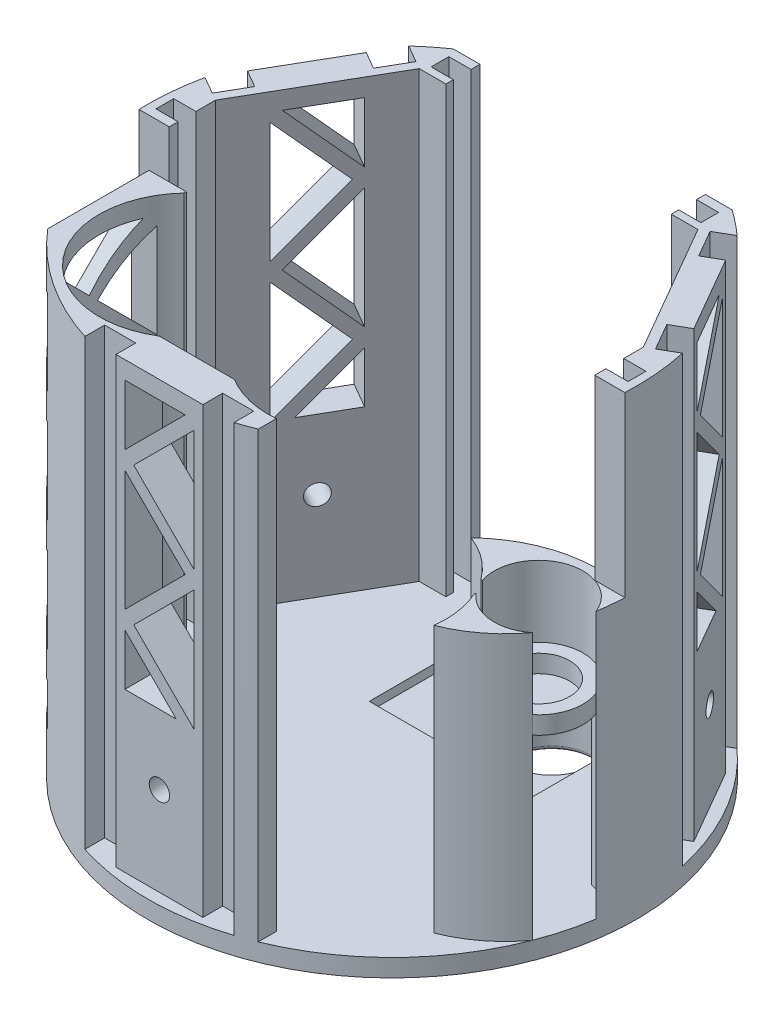
from build123d import *
from build123d.topology import SkipClean

# Parameters (mm, degrees)
BOSS_EXTRUDE1_DEPTH   = 50
BOSS_EXTRUDE1_2_DEPTH = 50
BOSS_EXTRUDE1_3_DEPTH = 50
BOSS_EXTRUDE1_4_DEPTH = 50
SKETCH3_R             = 1.15
CUT_EXTRUDE1_DEPTH    = 5
CUT_EXTRUDE2_DEPTH    = 5
SKETCH5_R             = 1.15
CUT_EXTRUDE3_DEPTH    = 5
SKETCH6_R             = 1.15
CUT_EXTRUDE5_DEPTH    = 10
CUT_EXTRUDE6_DEPTH    = 5
BOSS_EXTRUDE3_START   = 2
SKETCH8_R             = 27.5
BOSS_EXTRUDE3_DEPTH   = 2
SKETCH9_W             = 18.5
SKETCH9_H             = 14.5
CUT_EXTRUDE7_DEPTH    = 1
SKETCH10_R            = 4.5
CUT_EXTRUDE8_DEPTH    = 5
SKETCH11_W            = 12.695193893
SKETCH11_H            = 9.993108718
CUT_EXTRUDE13_DEPTH   = 20
SKETCH12_R            = 5
BOSS_EXTRUDE6_DEPTH   = 10
SKETCH13_R            = 3.5
CUT_EXTRUDE14_DEPTH   = 10
SKETCH14_W            = 13.78418651
SKETCH14_H            = 14.309460467
CUT_EXTRUDE15_DEPTH   = 20
SKETCH15_R            = 5
CUT_EXTRUDE17_DEPTH   = 8
CUT_EXTRUDE18_DEPTH   = 8
CUT_EXTRUDE31_START   = -7.634304072
CUT_EXTRUDE31_DEPTH   = 7.634304072
CUT_EXTRUDE32_DEPTH   = 1
SKETCH20_R            = 5.5
SKETCH20_R_2          = 4.5
BOSS_EXTRUDE7_DEPTH   = 3
FILLET1_R             = 3
FILLET2_R             = 0.5


with BuildPart() as part:
    # Sketch1 → Boss-Extrude1 (new body)
    with BuildSketch(Plane(origin=(0, 0, 0), x_dir=(1, 0, 0), z_dir=(0, 1, 0))):
        with BuildLine():
            Line((-8.393980876, -26.187613199), (-8.393980876, -23.960737702))
            Line((-8.393980876, -23.960737702), (-4.893980876, -23.960737702))
            Line((-4.893980876, -23.960737702), (-4.893980876, -26.187613199))
            Line((-4.893980876, -26.187613199), (4.893980876, -26.187613199))
            Line((4.893980876, -26.187613199), (4.893980876, -23.960737702))
            Line((4.893980876, -23.960737702), (8.393980876, -23.960737702))
            Line((8.393980876, -23.960737702), (8.393980876, -26.187613199))
            ThreePointArc((8.393980876, -26.187613199), (9.401021566, -25.843196271), (10.393980876, -25.460069944))
            Line((10.393980876, -25.460069944), (10.393980876, -23.42069745))
            ThreePointArc((10.393980876, -23.42069745), (7.194462573, -23.191333633), (4.232173124, -21.960737702))
            Line((4.232173124, -21.960737702), (-4.232173124, -21.960737702))
            ThreePointArc((-4.232173124, -21.960737702), (-17.23684506, -19.796448278), (-16.794443855, -6.620336482))
            Line((-16.794443855, -6.620336482), (-16.794443855, -6.372262144))
            Line((-16.794443855, -6.372262144), (-20.981030093, -6.372262144))
            Line((-20.981030093, -6.372262144), (-20.981030093, -17.77769322))
            ThreePointArc((-20.981030093, -17.77769322), (-15.277581807, -22.865814968), (-8.393980876, -26.187613199))
        make_face()
    extrude(amount=BOSS_EXTRUDE1_DEPTH)

    # Sketch6 → Cut-Extrude5 (cut)
    with BuildSketch(Plane(origin=(0, 0, 21.960737702), x_dir=(-1, 0, 0), z_dir=(0, 0, -1))):
        with Locations((0, 10)):
            Circle(SKETCH6_R)
    extrude(amount=-CUT_EXTRUDE5_DEPTH, mode=Mode.SUBTRACT)

    # Sketch7 → Cut-Extrude6 (cut)
    with BuildSketch(Plane(origin=(0, 0, 21.960737702), x_dir=(-1, 0, 0), z_dir=(0, 0, -1))):
        Polygon((3.893980876, 48), (-2.893980876, 48), (3.893980876, 41.212038249), align=None)
        Polygon((2.893980876, 40.212038249), (-3.893980876, 47), (-3.893980876, 33.424076497), align=None)
        Polygon((3.893980876, 25.636114746), (3.893980876, 39.212038249), (-2.893980876, 32.424076497), align=None)
        Polygon((2.893980876, 24.636114746), (-3.893980876, 31.424076497), (-3.893980876, 17.848152995), align=None)
        Polygon((3.893980876, 17.848152995), (3.893980876, 23.636114746), (-1.893980876, 17.848152995), align=None)
    extrude(amount=-CUT_EXTRUDE6_DEPTH, mode=Mode.SUBTRACT)


with BuildPart() as body_2:
    # Sketch1 → Boss-Extrude1 2 (new body)
    with BuildSketch(Plane(origin=(0, 0, 0), x_dir=(1, 0, 0), z_dir=(0, 1, 0))):
        with BuildLine():
            ThreePointArc((-26.876128733, 5.824405922), (-27.392326732, 2.431138875), (-27.481812167, -1))
            Line((-27.481812167, -1), (-24.081572577, -1))
            Line((-24.081572577, -1), (-24.081572577, 0))
            Line((-24.081572577, 0), (-26.581572577, 0))
            Line((-26.581572577, 0), (-26.581572577, 2))
            Line((-26.581572577, 2), (-24.081572577, 2))
            Line((-24.081572577, 2), (-24.081572577, 4.210968174))
            Line((-24.081572577, 4.210968174), (-15.687591702, 18.749769528))
            Line((-15.687591702, 18.749769528), (-12.687591702, 18.749769528))
            Line((-12.687591702, 18.749769528), (-12.687591702, 19.586488585))
            Line((-12.687591702, 19.586488585), (-15.187591702, 19.586488585))
            Line((-15.187591702, 19.586488585), (-15.187591702, 21.586488585))
            Line((-15.187591702, 21.586488585), (-12.687591702, 21.586488585))
            Line((-12.687591702, 21.586488585), (-12.687591702, 22.586488585))
            Line((-12.687591702, 22.586488585), (-15.687591702, 22.586488585))
            ThreePointArc((-15.687591702, 22.586488585), (-17.120996476, 21.520257426), (-18.482147857, 20.363207277))
            Line((-18.482147857, 20.363207277), (-16.553617105, 19.249769528))
            Line((-16.553617105, 19.249769528), (-18.303617105, 16.218680615))
            Line((-18.303617105, 16.218680615), (-20.232147857, 17.332118363))
            Line((-20.232147857, 17.332118363), (-25.126128733, 8.855494836))
            Line((-25.126128733, 8.855494836), (-23.197597981, 7.742057087))
            Line((-23.197597981, 7.742057087), (-24.947597981, 4.710968174))
            Line((-24.947597981, 4.710968174), (-26.876128733, 5.824405922))
        make_face()
    extrude(amount=BOSS_EXTRUDE1_2_DEPTH)

    # Sketch3 → Cut-Extrude1 (cut)
    with BuildSketch(Plane(origin=(-19.884582139, 0, -11.480368851), x_dir=(0.5000000000000068, 0, -0.8660254037844348), z_dir=(0.8660254037844347, 0, 0.5000000000000067))):
        with Locations((0, 10)):
            Circle(SKETCH3_R)
    extrude(amount=-CUT_EXTRUDE1_DEPTH, mode=Mode.SUBTRACT)

    # Sketch4 → Cut-Extrude2 (cut)
    with BuildSketch(Plane(origin=(-19.884582139, 0, -11.480368851), x_dir=(0.5000000000000068, 0, -0.8660254037844348), z_dir=(0.8660254037844347, 0, 0.5000000000000067))):
        Polygon((2.893980876, 40.212038249), (-3.893980876, 47), (-3.893980876, 33.424076497), align=None)
        Polygon((3.893980876, 48), (-2.893980876, 48), (3.893980876, 41.212038249), align=None)
        Polygon((3.893980876, 25.636114746), (3.893980876, 39.212038249), (-2.893980876, 32.424076497), align=None)
        Polygon((2.893980876, 24.636114746), (-3.893980876, 31.424076497), (-3.893980876, 17.848152995), align=None)
        Polygon((3.893980876, 17.848152995), (3.893980876, 23.636114746), (-1.893980876, 17.848152995), align=None)
    extrude(amount=-CUT_EXTRUDE2_DEPTH, mode=Mode.SUBTRACT)



with BuildPart() as body_3:
    # Sketch1 → Boss-Extrude1 3 (new body)
    with BuildSketch(Plane(origin=(0, 0, 0), x_dir=(1, 0, 0), z_dir=(0, 1, 0))):
        with BuildLine():
            ThreePointArc((19.422529868, -14.703074621), (22.887714657, -12.727446636), (25.668578652, -9.867830054))
            ThreePointArc((25.668578652, -9.867830054), (22.0554959, -10.980202416), (18.696522615, -9.245544605))
            Line((18.696522615, -9.245544605), (18.604343555, -9.324201902))
            ThreePointArc((18.604343555, -9.324201902), (19.386280696, -11.956924548), (19.422529868, -14.703074621))
        make_face()
    extrude(amount=BOSS_EXTRUDE1_3_DEPTH)


with BuildPart() as body_4:
    # Sketch1 → Boss-Extrude1 4 (new body)
    with BuildSketch(Plane(origin=(0, 0, 0), x_dir=(1, 0, 0), z_dir=(0, 1, 0))):
        with BuildLine():
            ThreePointArc((17.759528918, -7.589947772), (20.816423634, -1.291967436), (27.173744999, -4.223456253))
            ThreePointArc((27.173744999, -4.223456253), (27.487944561, 0.814189057), (26.876128733, 5.824405922))
            Line((26.876128733, 5.824405922), (24.947597981, 4.710968174))
            Line((24.947597981, 4.710968174), (23.197597981, 7.742057087))
            Line((23.197597981, 7.742057087), (25.126128733, 8.855494836))
            Line((25.126128733, 8.855494836), (20.232147857, 17.332118363))
            Line((20.232147857, 17.332118363), (18.303617105, 16.218680615))
            Line((18.303617105, 16.218680615), (16.553617105, 19.249769528))
            Line((16.553617105, 19.249769528), (18.482147857, 20.363207277))
            ThreePointArc((18.482147857, 20.363207277), (17.120996476, 21.520257426), (15.687591702, 22.586488585))
            Line((15.687591702, 22.586488585), (12.687591702, 22.586488585))
            Line((12.687591702, 22.586488585), (12.687591702, 21.586488585))
            Line((12.687591702, 21.586488585), (15.187591702, 21.586488585))
            Line((15.187591702, 21.586488585), (15.187591702, 19.586488585))
            Line((15.187591702, 19.586488585), (12.687591702, 19.586488585))
            Line((12.687591702, 19.586488585), (12.687591702, 18.749769528))
            Line((12.687591702, 18.749769528), (15.687591702, 18.749769528))
            Line((15.687591702, 18.749769528), (24.081572577, 4.210968174))
            Line((24.081572577, 4.210968174), (24.081572577, 2))
            Line((24.081572577, 2), (26.581572577, 2))
            Line((26.581572577, 2), (26.581572577, 0))
            Line((26.581572577, 0), (24.081572577, 0))
            ThreePointArc((24.081572577, 0), (18.098170165, -0.880137771), (12.966814099, -4.080908279))
            ThreePointArc((12.966814099, -4.080908279), (15.563201026, -5.508530882), (17.627279444, -7.634304072))
            Line((17.627279444, -7.634304072), (17.759528918, -7.589947772))
        make_face()
    extrude(amount=BOSS_EXTRUDE1_4_DEPTH)

    # Sketch5 → Cut-Extrude3 (cut)
    with BuildSketch(Plane(origin=(19.884582139, 0, -11.480368851), x_dir=(0.49999999999999295, 0, 0.8660254037844428), z_dir=(-0.8660254037844428, 0, 0.49999999999999295))):
        Polygon((2.893980876, 40.212038249), (-3.893980876, 47), (-3.893980876, 33.424076497), align=None)
        Polygon((3.893980876, 48), (-2.893980876, 48), (3.893980876, 41.212038249), align=None)
        Polygon((3.893980876, 25.636114746), (3.893980876, 39.212038249), (-2.893980876, 32.424076497), align=None)
        Polygon((2.893980876, 24.636114746), (-3.893980876, 31.424076497), (-3.893980876, 21.869049068), (-3.893980876, 17.848152995), align=None)
        Polygon((3.893980876, 21.869049068), (3.893980876, 23.636114746), (-1.893980876, 17.848152995), (3.893980876, 17.848152995), align=None)
        with Locations((0, 10)):
            Circle(SKETCH5_R)
    extrude(amount=-CUT_EXTRUDE3_DEPTH, mode=Mode.SUBTRACT)


with BuildPart() as body_2_1:
    with SkipClean():  # the faces are left unmerged after this step: merging them gives an invalid solid
        add(body_2.part)

        add(body_4.part)  # Boss-Extrude3 merges body 4

        add(part.part)  # Boss-Extrude3 merges part
        # Sketch8 → Boss-Extrude3 (add)
        with BuildSketch(Plane(origin=(0, 0, 0), x_dir=(-1, 0, 0), z_dir=(0, -1, 0)).offset(BOSS_EXTRUDE3_START)):
            with Locations(Location((0, 0, 0), (0, 0, 90))):
                Circle(SKETCH8_R)
        extrude(amount=-BOSS_EXTRUDE3_DEPTH)

    # Sketch9 → Cut-Extrude7 (cut)
    with SkipClean():  # the faces are left unmerged after this step: merging them gives an invalid solid
        with BuildSketch(Plane(origin=(0, 0, 0), x_dir=(1, 0, 0), z_dir=(0, 1, 0))):
            with Locations((2.437591702, 11.499769528)):
                Rectangle(SKETCH9_W, SKETCH9_H)
        extrude(amount=-CUT_EXTRUDE7_DEPTH, mode=Mode.SUBTRACT)

    # Sketch10 → Cut-Extrude8 (cut)
    with SkipClean():  # the faces are left unmerged after this step: merging them gives an invalid solid
        with BuildSketch(Plane(origin=(0, -1, 0), x_dir=(1, 0, 0), z_dir=(0, 1, 0))):
            with Locations(Location((6.487591702, 11.499769528, 0), (0, 0, 270))):
                Circle(SKETCH10_R)
        extrude(amount=-CUT_EXTRUDE8_DEPTH, mode=Mode.SUBTRACT)

    # Sketch11 → Cut-Extrude13 (cut)
    with SkipClean():  # the faces are left unmerged after this step: merging them gives an invalid solid
        with BuildSketch(Plane(origin=(0, 50, 0), x_dir=(1, 0, 0), z_dir=(0, 1, 0))):
            with Locations((17.733975631, -3.299007045)):
                Rectangle(SKETCH11_W, SKETCH11_H)
        extrude(amount=-CUT_EXTRUDE13_DEPTH, mode=Mode.SUBTRACT)


    with SkipClean():  # the faces are left unmerged after this step: merging them gives an invalid solid
        add(body_3.part)  # Boss-Extrude6 merges body 3
        # Sketch12 → Boss-Extrude6 (add)
        with BuildSketch(Plane(origin=(0, 30, 0), x_dir=(1, 0, 0), z_dir=(0, 1, 0))):
            with Locations((22.5, -6)):
                Circle(SKETCH12_R)
        extrude(amount=-BOSS_EXTRUDE6_DEPTH)

    # Sketch13 → Cut-Extrude14 (cut)
    with SkipClean():  # the faces are left unmerged after this step: merging them gives an invalid solid
        with BuildSketch(Plane(origin=(0, 30, 0), x_dir=(1, 0, 0), z_dir=(0, 1, 0))):
            with Locations(Location((22.5, -6, 0), (0, 0, 270))):
                Circle(SKETCH13_R)
        extrude(amount=-CUT_EXTRUDE14_DEPTH, mode=Mode.SUBTRACT)

    # Sketch14 → Cut-Extrude15 (cut)
    with SkipClean():  # the faces are left unmerged after this step: merging them gives an invalid solid
        with BuildSketch(Plane(origin=(0, 50, 0), x_dir=(1, 0, 0), z_dir=(0, 1, 0))):
            with BuildLine():
                ThreePointArc((27.173744999, -4.223456253), (25.961591897, -2.392039144), (24.081572577, -1.256728114))
                Line((24.081572577, -1.256728114), (24.081572577, -15.566188581))
                Line((24.081572577, -15.566188581), (29.290698472, -15.566188581))
                Line((29.290698472, -15.566188581), (29.290698472, -1.256728114))
                Line((29.290698472, -1.256728114), (27.471269254, -1.256728114))
                ThreePointArc((27.471269254, -1.256728114), (27.362744099, -2.744127429), (27.173744999, -4.223456253))
            make_face()
            with Locations((17.189479322, -8.411458347)):
                Rectangle(SKETCH14_W, SKETCH14_H)
            with BuildLine():
                Line((27.471269254, -1.256728114), (24.081572577, -1.256728114))
                ThreePointArc((24.081572577, -1.256728114), (25.961591897, -2.392039144), (27.173744999, -4.223456253))
                ThreePointArc((27.173744999, -4.223456253), (27.362744099, -2.744127429), (27.471269254, -1.256728114))
            make_face()
        extrude(amount=-CUT_EXTRUDE15_DEPTH, mode=Mode.SUBTRACT)

    # Sketch15 → Cut-Extrude17 (cut)
    with SkipClean():  # the faces are left unmerged after this step: merging them gives an invalid solid
        with BuildSketch(Plane(origin=(0, 30, 0), x_dir=(1, 0, 0), z_dir=(0, 1, 0))):
            with Locations((22.5, -6)):
                Circle(SKETCH15_R)
        extrude(amount=-CUT_EXTRUDE17_DEPTH, mode=Mode.SUBTRACT)

    # Sketch16 → Cut-Extrude18 (cut)
    with SkipClean():  # the faces are left unmerged after this step: merging them gives an invalid solid
        with BuildSketch(Plane.ZY.offset(20.981030093)):
            Polygon((13.666499923, 41.705762221), (8.372262144, 47), (8.372262144, 36.411524442), align=None)
            Polygon((17.77769322, 48), (9.372262144, 48), (14.666499923, 42.705762221), (17.77769322, 45.816955519), align=None)
            Polygon((19.960737702, 48), (17.77769322, 48), (17.77769322, 45.816955519), align=None)
            Polygon((20.960737702, 47), (17.77769322, 43.816955519), (17.77769322, 39.594568924), (20.960737702, 36.411524442), align=None)
            Polygon((17.77769322, 43.816955519), (15.666499923, 41.705762221), (17.77769322, 39.594568924), align=None)
            Polygon((14.666499923, 40.705762221), (9.372262144, 35.411524442), (14.666499923, 30.117286664), (17.77769322, 33.228479961), (17.77769322, 37.594568924), align=None)
            Polygon((19.960737702, 35.411524442), (17.77769322, 37.594568924), (17.77769322, 33.228479961), align=None)
            Polygon((20.960737702, 23.823048885), (20.960737702, 34.411524442), (17.77769322, 31.228479961), (17.77769322, 27.006093366), align=None)
            Polygon((17.77769322, 31.228479961), (15.666499923, 29.117286664), (17.77769322, 27.006093366), align=None)
            Polygon((14.666499923, 28.117286664), (9.372262144, 22.823048885), (14.666499923, 17.528811106), (17.77769322, 20.640004403), (17.77769322, 25.006093366), align=None)
            Polygon((13.666499923, 29.117286664), (8.372262144, 34.411524442), (8.372262144, 23.823048885), align=None)
            Polygon((13.666499923, 16.528811106), (8.372262144, 21.823048885), (8.372262144, 11.234573327), align=None)
            Polygon((20.960737702, 11.234573327), (20.960737702, 21.823048885), (17.77769322, 18.640004403), (17.77769322, 14.417617809), align=None)
            Polygon((17.77769322, 18.640004403), (15.666499923, 16.528811106), (17.77769322, 14.417617809), align=None)
            Polygon((14.666499923, 15.528811106), (9.372262144, 10.234573327), (14.666499923, 4.940335548), (17.77769322, 8.051528846), (17.77769322, 12.417617809), align=None)
            Polygon((13.666499923, 3.940335548), (8.372262144, 9.234573327), (8.372262144, 3.940335548), align=None)
            Polygon((20.960737702, 3.940335548), (20.960737702, 9.234573327), (17.77769322, 6.051528846), (17.77769322, 3.940335548), align=None)
            Polygon((17.77769322, 6.051528846), (15.666499923, 3.940335548), (17.77769322, 3.940335548), align=None)
            Polygon((19.960737702, 10.234573327), (17.77769322, 12.417617809), (17.77769322, 8.051528846), align=None)
            Polygon((19.960737702, 22.823048885), (17.77769322, 25.006093366), (17.77769322, 20.640004403), align=None)
        extrude(amount=-CUT_EXTRUDE18_DEPTH, mode=Mode.SUBTRACT)

    # Cut-Extrude31: read off the stored shape, not the designer's step
    # Cut-Extrude31 outline → Cut-Extrude31 (cut)
    with SkipClean():  # the faces are left unmerged after this step: merging them gives an invalid solid
        with BuildSketch(Plane(origin=(0, 0, 0), x_dir=(-1, 0, 0), z_dir=(0, 0, -1)).offset(CUT_EXTRUDE31_START)):
            with BuildLine():
                Line((-9.081572577, 20), (-22.581572577, 20))
                ThreePointArc((-22.581572577, 20), (-23.088469455, 19.958047932), (-23.581572577, 19.833333333))
                Line((-23.581572577, 19.833333333), (-23.581572577, 0))
                Line((-23.581572577, 0), (-9.081572577, 0))
                Line((-9.081572577, 0), (-9.081572577, 20))
            make_face()
        extrude(amount=CUT_EXTRUDE31_DEPTH, mode=Mode.SUBTRACT)

    # Sketch19 → Cut-Extrude32 (cut)
    with SkipClean():  # the faces are left unmerged after this step: merging them gives an invalid solid
        with BuildSketch(Plane.XY):
            with BuildLine():
                Line((22.313623385, 0), (23.581572577, 0))
                Line((23.581572577, 0), (23.581572577, 19))
                ThreePointArc((23.581572577, 19), (23.288679358, 19.707106781), (22.581572577, 20))
                Line((22.581572577, 20), (22.313623385, 20))
                Line((22.313623385, 20), (22.313623385, 0))
            make_face()
        extrude(amount=-CUT_EXTRUDE32_DEPTH, mode=Mode.SUBTRACT)

    # Sketch20 → Boss-Extrude7 (add)
    with SkipClean():  # the faces are left unmerged after this step: merging them gives an invalid solid
        with BuildSketch(Plane(origin=(0, -2, 0), x_dir=(-1, 0, 0), z_dir=(0, -1, 0))):
            with Locations(Location((-6.487591702, 11.499769528, 0), (0, 0, 90))):
                Circle(SKETCH20_R)
            with Locations(Location((-6.487591702, 11.499769528, 0), (0, 0, 270))):
                Circle(SKETCH20_R_2, mode=Mode.SUBTRACT)
        extrude(amount=BOSS_EXTRUDE7_DEPTH)

    # Fillet1
    fillet1_edges = [body_2_1.edges().sort_by_distance(p)[0] for p in [
        (6.487591702, -2, -5.999769528),
    ]]
    fillet(fillet1_edges, radius=FILLET1_R - 0.0001)  # a hair under: the kernel refuses the full size

    # Fillet2
    fillet2_edges = [body_2_1.edges().sort_by_distance(p)[0] for p in [
        (6.487591702, -5, -5.999769528),
        (6.487591702, -5, -15.999769528),
    ]]
    fillet(fillet2_edges, radius=FILLET2_R)


solid = body_2_1.part
